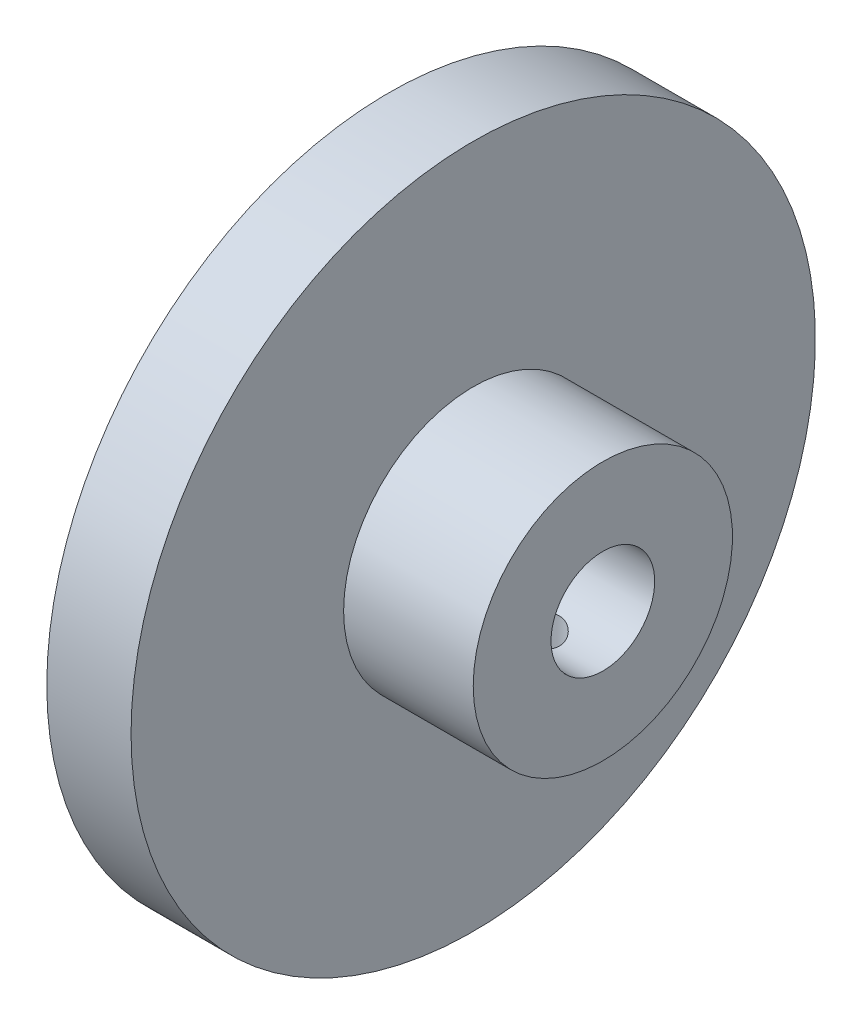
from build123d import *

# Parameters (mm, degrees)
SKETCH2_R          = 1.65
CUT_EXTRUDE1_DEPTH = 10


with BuildPart() as part:
    # Sketch1 → Revolve1 (revolve)
    with BuildSketch(Plane(origin=(0, 0, 0), x_dir=(1, 0, 0), z_dir=(0, 1, 0))):
        Polygon((0, 4), (0, 26.4), (6.5, 26.4), (6.5, 10), (16.5, 10), (16.5, 4), align=None)
    revolve(axis=Axis((-31.608899315, 0, 0), (1, 0, 0)))

    # Sketch2 → Cut-Extrude1 (cut)
    with BuildSketch(Plane(origin=(0, 0, 0), x_dir=(1, 0, 0), z_dir=(0, 1, 0))):
        with Locations((11.5, 0)):
            Circle(SKETCH2_R)
    extrude(amount=-CUT_EXTRUDE1_DEPTH, mode=Mode.SUBTRACT)


solid = part.part
